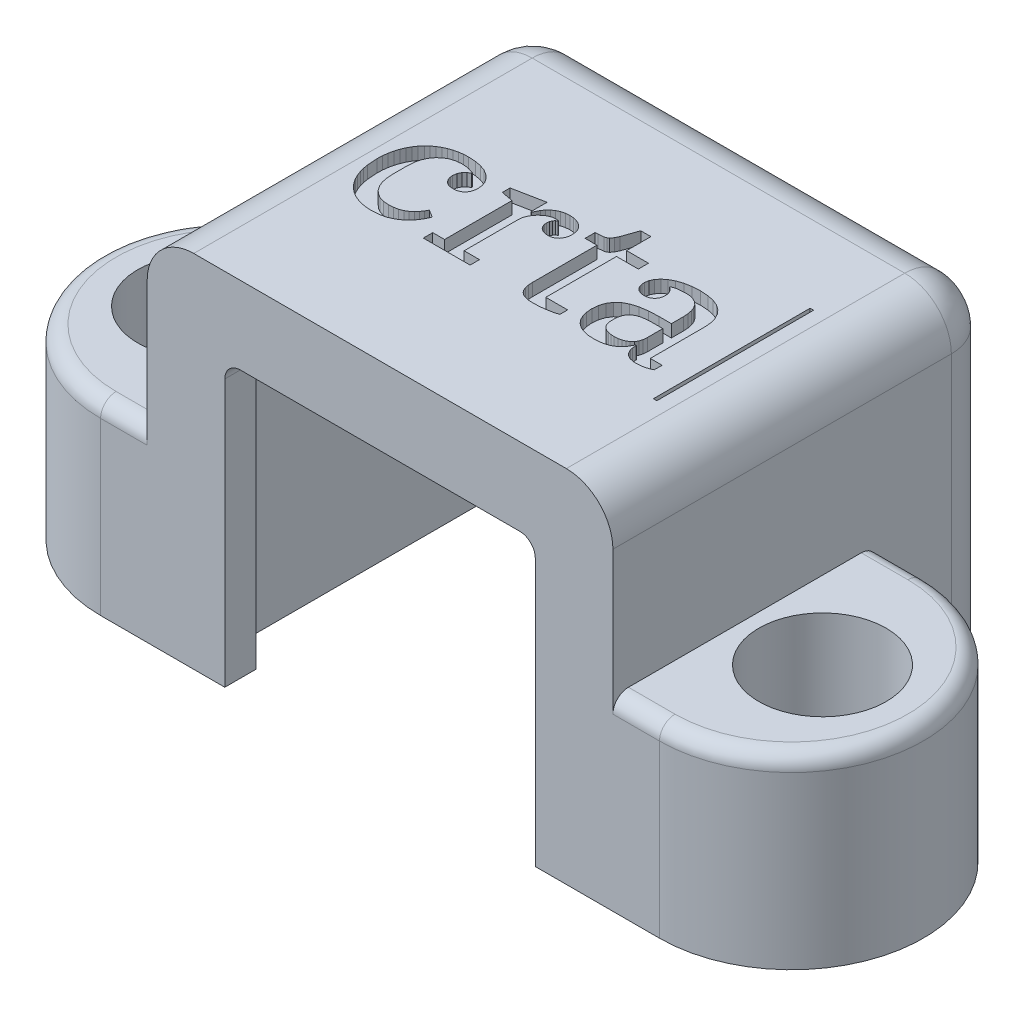
from build123d import *

# Parameters (mm, degrees)
BOSS_EXTRUDE1_DEPTH = 12.4
BOSS_EXTRUDE2_DEPTH = 6
SKETCH4_R           = 2.05
CUT_EXTRUDE1_DEPTH  = 6
FILLET1_R           = 1.5
FILLET2_R           = 0.5
FILLET3_R           = 1
BOSS_EXTRUDE3_DEPTH = 1
FILLET4_R           = 0.5
BOSS_EXTRUDE4_DEPTH = 1
FILLET5_R           = 1.5
SKETCH8_W           = 0.11246304
SKETCH8_H           = 5.04959104
CUT_EXTRUDE2_DEPTH  = 0.4


with BuildPart() as part:
    # Sketch1 → Boss-Extrude1 (new body)
    with BuildSketch(Plane.XY):
        Polygon((0, 0), (6, 0), (6, -10.1), (7.5, -10.1), (7.5, 1.5), (0, 1.5), (-7.5, 1.5), (-7.5, -10.1), (-6, -10.1), (-6, 0), align=None)
    extrude(amount=BOSS_EXTRUDE1_DEPTH)

    # Sketch3 → Boss-Extrude2 (add)
    with BuildSketch(Plane.XZ.offset(10.1)):
        with BuildLine():
            Line((7.5, 3.9), (7.5, 12.4))
            Line((7.5, 12.4), (9, 12.4))
            ThreePointArc((9, 12.4), (13.25, 8.15), (9, 3.9))
            Line((9, 3.9), (7.5, 3.9))
        make_face()
        with BuildLine():
            Line((-7.5, 12.4), (-9, 12.4))
            ThreePointArc((-9, 12.4), (-13.25, 8.15), (-9, 3.9))
            Line((-9, 3.9), (-7.5, 3.9))
            Line((-7.5, 3.9), (-7.5, 12.4))
        make_face()
    extrude(amount=-BOSS_EXTRUDE2_DEPTH)

    # Sketch4 → Cut-Extrude1 (cut)
    with BuildSketch(Plane.XZ.offset(10.1)):
        with Locations(Location((-10, 8.15, 0), (0, 0, 270))):
            Circle(SKETCH4_R)
        with Locations(Location((10, 8.15, 0), (0, 0, 270))):
            Circle(SKETCH4_R)
    extrude(amount=-CUT_EXTRUDE1_DEPTH, mode=Mode.SUBTRACT)

    # Fillet1
    fillet1_edges = [part.edges().sort_by_distance(p)[0] for p in [
        (-7.5, 1.5, 6.2),
        (7.5, 1.5, 6.2),
    ]]
    fillet(fillet1_edges, radius=FILLET1_R)

    # Fillet2
    fillet2_edges = [part.edges().sort_by_distance(p)[0] for p in [
        (8.25, -4.1, 3.9),
        (8.25, -4.1, 12.4),
        (13.25, -4.1, 8.15),
        (-13.25, -4.1, 8.15),
        (-8.25, -4.1, 12.4),
        (-8.25, -4.1, 3.9),
    ]]
    fillet(fillet2_edges, radius=FILLET2_R)

    # Fillet3
    fillet3_edges = [part.edges().sort_by_distance(p)[0] for p in [
        (6, 0, 6.2),
        (-6, 0, 6.2),
    ]]
    fillet(fillet3_edges, radius=FILLET3_R)

    # Sketch6 → Boss-Extrude3 (add)
    with BuildSketch(Plane(origin=(0, 0, 12.4), x_dir=(-1, 0, 0), z_dir=(0, 0, -1))):
        with BuildLine():
            Line((6, -10.1), (6, -1))
            ThreePointArc((6, -1), (5.707106781, -0.292893219), (5, 0))
            Line((5, 0), (-5, 0))
            ThreePointArc((-5, 0), (-5.707106781, -0.292893219), (-6, -1))
            Line((-6, -1), (-6, -10.1))
            Line((-6, -10.1), (-5, -10.1))
            Line((-5, -10.1), (-5, -1))
            Line((-5, -1), (5, -1))
            Line((5, -1), (5, -10.1))
            Line((5, -10.1), (6, -10.1))
        make_face()
    extrude(amount=BOSS_EXTRUDE3_DEPTH)

    # Fillet4
    fillet4_edges = [part.edges().sort_by_distance(p)[0] for p in [
        (5, -1, 11.9),
        (-5, -1, 11.9),
    ]]
    fillet(fillet4_edges, radius=FILLET4_R)

    # Sketch7 → Boss-Extrude4 (add)
    with BuildSketch(Plane(origin=(0, 0, 5.55), x_dir=(-1, 0, 0), z_dir=(0, 0, -1))):
        with BuildLine():
            Line((-4, 0), (-5, 0))
            ThreePointArc((-5, 0), (-5.707106781, -0.292893219), (-6, -1))
            Line((-6, -1), (-6, -2))
            Line((-6, -2), (-4, 0))
        make_face()
        with BuildLine():
            ThreePointArc((5, 0), (5.707106781, -0.292893219), (6, -1))
            Line((6, -1), (6, -2))
            Line((6, -2), (4, 0))
            Line((4, 0), (5, 0))
        make_face()
    extrude(amount=BOSS_EXTRUDE4_DEPTH)

    # Fillet5
    fillet5_edges = [part.edges().sort_by_distance(p)[0] for p in [
        (-7.5, -5.05, 0),
        (-7.060660172, 1.060660172, 0),
        (0, 1.5, 0),
        (7.060660172, 1.060660172, 0),
        (7.5, -5.05, 0),
    ]]
    fillet(fillet5_edges, radius=FILLET5_R - 0.0001)  # a hair under: the kernel refuses the full size

    # Sketch8 → Cut-Extrude2 (cut)
    # profile 1 of 5: a face of its own
    with BuildSketch(Plane(origin=(0, 1.5, 0), x_dir=(1, 0, 0), z_dir=(0, 1, 0))):
        Polygon((-4.32061755, -8.341909938), (-4.48192763, -8.334879938), (-4.63410283, -8.313791458), (-4.77714315, -8.278646338), (-4.91104859, -8.229446898), (-5.03264827, -8.167595298), (-5.14440667, -8.094493938), (-5.24632595, -8.010144978), (-5.33840819, -7.914550338), (-5.42029739, -7.808412258), (-5.49163915, -7.692433058), (-5.55243739, -7.566614658), (-5.60269635, -7.430959218), (-5.64206155, -7.286868978), (-5.67017699, -7.135746418), (-5.69266683, -6.812412418), (-5.68599035, -6.637387698), (-5.66595955, -6.472206178), (-5.63257243, -6.316867938), (-5.58582691, -6.171372978), (-5.52713323, -6.033604738), (-5.45790019, -5.907082098), (-5.37812379, -5.791807138), (-5.28779979, -5.687781858), (-5.18798683, -5.595354418), (-5.07974315, -5.514872658), (-4.96306483, -5.446338818), (-4.83794763, -5.389754818), (-4.70299611, -5.343009218), (-4.56241859, -5.309622098), (-4.41621531, -5.289591378), (-4.26438603, -5.282914898), (-4.03594859, -5.295566978), (-3.83421763, -5.333523298), (-3.65919531, -5.396783698), (-3.51088363, -5.485348418), (-3.39033419, -5.593595138), (-3.30422995, -5.715900418), (-3.25256899, -5.852262178), (-3.23534915, -6.002678418), (-3.24202555, -6.095809858), (-3.26205635, -6.178401938), (-3.29544347, -6.250450658), (-3.34218899, -6.311951858), (-3.40018187, -6.358697378), (-3.46730963, -6.392084498), (-3.54357227, -6.412115298), (-3.62896979, -6.418791698), (-3.71612971, -6.412465698), (-3.79204395, -6.393487538), (-3.85671059, -6.361857298), (-3.91012747, -6.317574978), (-3.95194651, -6.260989938), (-3.98181987, -6.198082978), (-3.99974539, -6.128850018), (-4.00572099, -6.053286818), (-3.98885155, -5.932389058), (-3.93824323, -5.828360738), (-3.86092763, -5.745419218), (-3.76392547, -5.687781858), (-3.76392547, -5.659666098), (-3.93262003, -5.609057778), (-4.04648891, -5.587973698), (-4.18566195, -5.580942018), (-4.36279123, -5.597811458), (-4.52305107, -5.648419778), (-4.66362715, -5.729952818), (-4.78171611, -5.839606978), (-4.87731515, -5.970345298), (-4.95041067, -6.126387778), (-4.99258707, -6.304920178), (-5.00664219, -6.503138978), (-5.00664219, -6.992353298), (-4.99363971, -7.192327698), (-4.95463075, -7.370513058), (-4.88961339, -7.526907298), (-4.79858555, -7.661508498), (-4.68506611, -7.767297138), (-4.55257259, -7.842857858), (-4.40110099, -7.888192818), (-4.23064715, -7.903304018), (-4.07144163, -7.894165378), (-3.93121427, -7.866750818), (-3.80996499, -7.821062338), (-3.70769395, -7.757102018), (-3.61772043, -7.679785778), (-3.53899659, -7.594030658), (-3.47152051, -7.499840738), (-3.41529003, -7.397220258), (-3.17349443, -7.543422258), (-3.23535187, -7.688212978), (-3.31969643, -7.830203058), (-3.42653083, -7.965161458), (-3.55586883, -8.088868098), (-3.70909971, -8.191485138), (-3.88763483, -8.274432098), (-4.09147411, -8.325040498), align=None)
    # profile 2 of 5: a face of its own
    with BuildSketch(Plane(origin=(0, 1.5, 0), x_dir=(1, 0, 0), z_dir=(0, 1, 0))):
        Polygon((-2.73256019, -7.970781858), (-2.35018579, -7.970781858), (-2.35018579, -5.800244898), (-2.73256019, -5.727143938), (-2.73256019, -5.479725218), (-1.73726219, -5.282914898), (-1.73726219, -5.805868098), (-1.70914643, -5.805868098), (-1.61355283, -5.614680898), (-1.54607771, -5.524715938), (-1.46735083, -5.445986338), (-1.37175179, -5.379908818), (-1.26491739, -5.327900098), (-1.13979947, -5.294163938), (-1.00062915, -5.282914898), (-0.87797107, -5.290999218), (-0.76867139, -5.315250738), (-0.67272803, -5.355667538), (-0.59013907, -5.412247378), (-0.52125235, -5.483938498), (-0.47205011, -5.569690178), (-0.44253027, -5.669502498), (-0.43269075, -5.783375458), (-0.43901683, -5.874052898), (-0.45799499, -5.954887138), (-0.48962515, -6.025878018), (-0.53390755, -6.087025698), (-0.58627003, -6.133771298), (-0.64777363, -6.167158418), (-0.71841619, -6.187189138), (-0.79819571, -6.193865618), (-0.88078883, -6.188243538), (-0.95424091, -6.171375778), (-1.01855403, -6.143260338), (-1.07373019, -6.103895218), (-1.11554931, -6.053290898), (-1.14542259, -5.997060738), (-1.16334811, -5.935204738), (-1.16932379, -5.867722738), (-1.15948595, -5.780563938), (-1.12996171, -5.710274498), (-1.08638227, -5.656851778), (-1.03436811, -5.631550338), (-1.03436811, -5.614680898), (-1.07373019, -5.609057778), (-1.14120803, -5.603434578), (-1.24804787, -5.617489698), (-1.35488779, -5.659666098), (-1.45188715, -5.724332338), (-1.54045187, -5.805868098), (-1.61214427, -5.897247058), (-1.66978435, -6.002678418), (-1.70774059, -6.109518338), (-1.72039275, -6.216358258), (-1.72039275, -7.970781858), (-1.22555531, -7.970781858), (-1.22555531, -8.274432098), (-2.73256019, -8.274432098), align=None)
    # profile 3 of 5: a face of its own
    with BuildSketch(Plane(origin=(0, 1.5, 0), x_dir=(1, 0, 0), z_dir=(0, 1, 0))):
        Polygon((0.84143653, -8.319417298), (0.69312485, -8.310982578), (0.56871093, -8.285678418), (0.46819669, -8.243504738), (0.39158437, -8.184461618), (0.33500445, -8.107144338), (0.29458773, -8.010146658), (0.27033613, -7.893466578), (0.26225181, -7.757102018), (0.26225181, -5.676535618), (-0.12012259, -5.676535618), (-0.12012259, -5.350392738), (-0.02452899, -5.350392738), (0.15120005, -5.332120258), (0.21481061, -5.309276498), (0.26225181, -5.277291778), (0.33394429, -5.187321298), (0.39158437, -5.063611938), (0.56590205, -4.568774498), (0.89204493, -4.568774498), (0.89204493, -5.350392738), (1.59493901, -5.350392738), (1.59493901, -5.676535618), (0.89204493, -5.676535618), (0.89204493, -7.953912418), (1.59493901, -7.953912418), (1.59493901, -8.201331138), (1.46982389, -8.243502018), (1.28566557, -8.280055218), (1.07057725, -8.309579538), align=None)
    # profile 4 of 5: a face of its own
    with BuildSketch(Plane(origin=(0, 1.5, 0), x_dir=(1, 0, 0), z_dir=(0, 1, 0))):
        Polygon((2.83387765, -8.341909938), (2.62793077, -8.328553938), (2.44869445, -8.288487218), (2.29616677, -8.221711938), (2.17034565, -8.128230098), (2.07440061, -8.008739138), (2.00586845, -7.869567858), (1.96474917, -7.710714098), (1.95104269, -7.532175938), (1.97002085, -7.331496578), (2.02695525, -7.156827778), (2.12184597, -7.008167378), (2.25469293, -6.885513378), (2.43041749, -6.789568338), (2.65393957, -6.721036178), (2.92525701, -6.679916898), (3.24436781, -6.666210418), (3.64923485, -6.666210418), (3.64923485, -6.283836098), (3.63974573, -6.122517778), (3.61127853, -5.981586098), (3.56383317, -5.861041138), (3.49740973, -5.760882898), (3.41060333, -5.682161858), (3.30200789, -5.625929938), (3.17162141, -5.592189298), (3.01944173, -5.580942018), (2.77764613, -5.600625778), (2.68205461, -5.625227378), (2.60332845, -5.659666098), (2.60332845, -5.682158738), (2.66236877, -5.721515298), (2.71579149, -5.783375458), (2.75796789, -5.864908418), (2.77202301, -5.974562658), (2.76604741, -6.049424978), (2.74812189, -6.116552738), (2.71824853, -6.175945938), (2.67642941, -6.227604498), (2.62617045, -6.269423618), (2.56537213, -6.299296978), (2.49403045, -6.317222498), (2.41214125, -6.323198098), (2.34185493, -6.317222498), (2.27718829, -6.299296978), (2.21814349, -6.269423618), (2.16472253, -6.227604498), (2.12290341, -6.172778818), (2.09303005, -6.109518338), (2.07510453, -6.037823138), (2.06912893, -5.957693218), (2.08740141, -5.831175058), (2.14222989, -5.710274498), (2.23782349, -5.593588578), (2.36715605, -5.490971538), (2.52881613, -5.405223938), (2.72141461, -5.339146418), (2.95055261, -5.296970018), (3.21062893, -5.282914898), (3.45875357, -5.298379618), (3.67454173, -5.344772338), (3.85799541, -5.422090978), (4.00911661, -5.530333618), (4.12720277, -5.666339458), (4.21155005, -5.826949458), (4.26215845, -6.012163378), (4.27902789, -6.221981378), (4.27902789, -7.976404978), (4.66140229, -7.976404978), (4.66140229, -8.229446898), (4.57143733, -8.271617778), (4.45896877, -8.308170978), (4.33104205, -8.333475218), (4.19468061, -8.341909938), (4.07378077, -8.333825618), (3.96975453, -8.309574018), (3.88259773, -8.269157298), (3.81230621, -8.212577458), (3.76064349, -8.140531778), (3.72374157, -8.059349218), (3.70160045, -7.969027698), (3.69422005, -7.869565138), (3.69422005, -7.841449378), (3.66610429, -7.841449378), (3.56488749, -8.027013378), (3.49319509, -8.108546338), (3.40181613, -8.184461618), (3.29498165, -8.249127938), (3.16564365, -8.296924738), (3.01241277, -8.330660898), align=None)
        Polygon((3.08129637, -7.948289218), (3.19937845, -7.940908818), (3.30621701, -7.918767698), (3.40181197, -7.881865778), (3.48616341, -7.830203058), (3.55750405, -7.761670898), (3.60846421, -7.674160578), (3.63904181, -7.567672098), (3.64923485, -7.442205538), (3.64923485, -6.941744898), (3.31184565, -6.941744898), (3.12734005, -6.949829218), (2.97305621, -6.974080818), (2.84899405, -7.014497538), (2.75515357, -7.071077458), (2.68626685, -7.142768498), (2.63706461, -7.228520178), (2.60754477, -7.328332578), (2.59770525, -7.442205538), (2.59770525, -7.549045378), (2.60578957, -7.643936098), (2.63004117, -7.726174738), (2.67045789, -7.795761218), (2.72703781, -7.852695618), (2.79767453, -7.894514738), (2.88026317, -7.924388098), (2.97480381, -7.942313618), align=None, mode=Mode.SUBTRACT)
    # profile 5 of 5: a face of its own
    with BuildSketch(Plane(origin=(0, 1.5, 0), x_dir=(1, 0, 0), z_dir=(0, 1, 0))):
        with Locations((5.50900469, -6.525631618)):
            Rectangle(SKETCH8_W, SKETCH8_H)
    extrude(amount=-CUT_EXTRUDE2_DEPTH, mode=Mode.SUBTRACT)


solid = part.part
